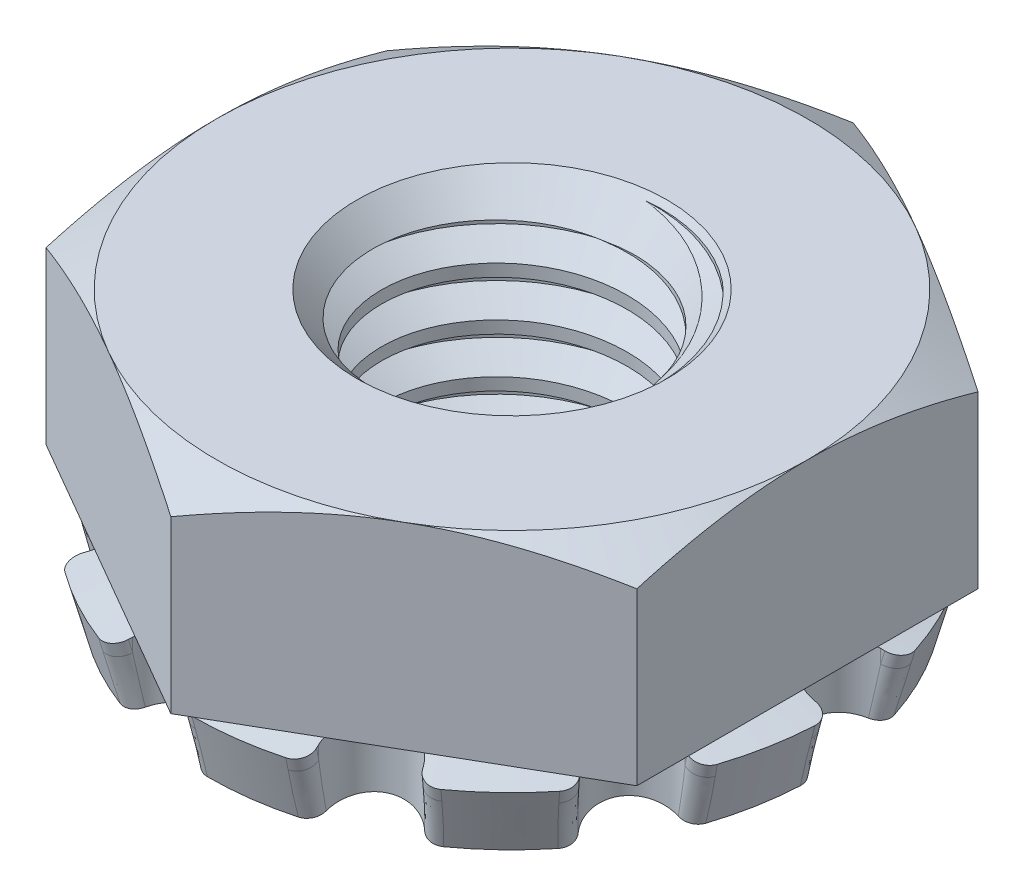
from build123d import *

# Parameters (mm, degrees)
BOSS_EXTRUDE1_DEPTH          = 4.365625
SKETCH2_OUTSIDE_W            = 47.418
SKETCH2_OUTSIDE_H            = 48.89
SKETCH2_OUTSIDE_R            = 4.7625
CUT_EXTRUDE1_DEPTH           = 9.484218461
CUT_EXTRUDE1_DRAFT           = -60
SKETCH4_R                    = 2.413
CUT_EXTRUDE3_DEPTH           = 4.365625
SWEEP1_PITCH                 = 0.79375
SWEEP1_HEIGHT                = 5.159375
SWEEP1_RADIUS                = 2.413
SKETCH7_R                    = 2.498925958
CUT_EXTRUDE4_OTHER_WAY_DEPTH = 9.93302879
CUT_EXTRUDE4_OTHER_WAY_TAPER = -45
SKETCH8_R                    = 2.498925958
CUT_EXTRUDE5_OTHER_WAY_DEPTH = 9.484218633
CUT_EXTRUDE5_OTHER_WAY_TAPER = -45
SKETCH9_W                    = 1.895636314
SKETCH9_H                    = 1.190625
CUT_EXTRUDE6_DEPTH           = 1.190625
FILLET1_R                    = 0.254
CIRPATTERN1_COUNT            = 10
FILLET1_OF_CIRPATTERN1_R     = 0.254


with BuildPart() as part:
    # Sketch1 → Boss-Extrude1 (new body)
    with BuildSketch(Plane(origin=(0, 0, 0), x_dir=(1, 0, 0), z_dir=(0, 1, 0))):
        Polygon((0, 5.499261314), (-4.7625, 2.749630657), (-4.7625, -2.749630657), (0, -5.499261314), (4.7625, -2.749630657), (4.7625, 2.749630657), align=None)
    extrude(amount=BOSS_EXTRUDE1_DEPTH)


with BuildPart() as cut_extrude1_tool:
    # Sketch2 outside → Cut-Extrude1 (with draft: the straight prism first)
    with BuildSketch(Plane(origin=(0, 4.365625, 0), x_dir=(1, 0, 0), z_dir=(0, 1, 0))):
        Rectangle(SKETCH2_OUTSIDE_W, SKETCH2_OUTSIDE_H)
        Circle(SKETCH2_OUTSIDE_R, mode=Mode.SUBTRACT)
    extrude(amount=-CUT_EXTRUDE1_DEPTH)
    # Cut-Extrude1: the draft: its side faces are tilted about the plane it starts from
    cut_extrude1_sides = [cut_extrude1_tool.faces().sort_by_distance(p)[0] for p in [
        (0, -0.37648423, 24.445),
        (23.709, -0.37648423, 0),
        (0, -0.37648423, -24.445),
        (-23.709, -0.37648423, 0),
        (-4.7625, -0.37648423, 0),
    ]]
    draft(cut_extrude1_sides, Plane(origin=(0, 4.365625, 0), x_dir=(1, 0, 0), z_dir=(0, 1, 0)), CUT_EXTRUDE1_DRAFT)


with BuildPart() as part_1:
    add(part.part)

    # Cut-Extrude1: cut by cut_extrude1_tool
    add(cut_extrude1_tool.part, mode=Mode.SUBTRACT)

    # Sketch4 → Cut-Extrude3 (cut)
    with BuildSketch(Plane(origin=(0, 4.365625, 0), x_dir=(1, 0, 0), z_dir=(0, 1, 0))):
        with Locations(Location((0, 0, 0), (0, 0, 270))):
            Circle(SKETCH4_R)
    extrude(amount=-CUT_EXTRUDE3_DEPTH, mode=Mode.SUBTRACT)

    # Sweep1: sweep along a helix
    with BuildLine() as sweep1_path:
        Helix(SWEEP1_PITCH, SWEEP1_HEIGHT, SWEEP1_RADIUS, center=(0, 4.365625, 0), direction=(0, -1, 0))
    # Sketch6 → Sweep1 (sweep)
    with BuildSketch(Plane(origin=(0, 0, 0), x_dir=(0, 0, -1), z_dir=(1, 0, 0))):
        Polygon((2.455962979, 5.084960937), (1.98337021, 4.812109375), (1.98337021, 4.613671875), (2.455962979, 4.340820312), align=None)
    sweep(path=sweep1_path.line, is_frenet=True)

    # Cut-Extrude4 cone 1 section (through the dimple's axis) → Cut-Extrude4 (revolve, cut)
    with BuildSketch(Plane(origin=(0, 4.365625, 0), x_dir=(0, 0, 1), z_dir=(1, 0, 0))):
        Polygon((0, 0), (2.498925958, 0), (0, 2.498925958), align=None)
    revolve(axis=Axis((0, 4.365625, 0), (0, -1, 0)), mode=Mode.SUBTRACT)

    # Sketch7 → Cut-Extrude4 other way (cut)
    with BuildSketch(Plane(origin=(0, 4.365625, 0), x_dir=(1, 0, 0), z_dir=(0, 1, 0))):
        Circle(SKETCH7_R)
    extrude(amount=CUT_EXTRUDE4_OTHER_WAY_DEPTH, taper=CUT_EXTRUDE4_OTHER_WAY_TAPER, mode=Mode.SUBTRACT)

    # Cut-Extrude5 cone 1 section (through the dimple's axis) → Cut-Extrude5 (revolve, cut)
    with BuildSketch(Plane(origin=(0, 0, 0), x_dir=(0, 0, -1), z_dir=(1, 0, 0))):
        Polygon((0, 0), (2.498925958, 0), (0, 2.498925958), align=None)
    revolve(axis=Axis((0, 0, 0), (0, 1, 0)), mode=Mode.SUBTRACT)

    # Sketch8 → Cut-Extrude5 other way (cut)
    with BuildSketch(Plane.XZ):
        Circle(SKETCH8_R)
    extrude(amount=CUT_EXTRUDE5_OTHER_WAY_DEPTH, taper=CUT_EXTRUDE5_OTHER_WAY_TAPER, mode=Mode.SUBTRACT)

    # Sketch9 → Cut-Revolve1 (revolve, cut)
    with BuildSketch(Plane(origin=(0, 0, 0), x_dir=(0, 0, -1), z_dir=(1, 0, 0)), mode=Mode.PRIVATE) as cut_revolve1_sk:
        with Locations((4.551443157, 0.5953125)):
            Rectangle(SKETCH9_W, SKETCH9_H)
    revolve(cut_revolve1_sk.sketch.rotate(Axis((0, 0, 0), (0, 1, 0)), 301.134377146), axis=Axis((0, 0, 0), (0, 1, 0)), mode=Mode.SUBTRACT)

    # Sketch10 → Revolve1 (revolve)
    with BuildSketch(Plane(origin=(0, 0, 0), x_dir=(0, 0, -1), z_dir=(1, 0, 0)), mode=Mode.PRIVATE) as revolve1_sk:
        Polygon((3.603625, 1.190625), (4.394982425, 1.190625), (5.159375, 0.985806627), (4.89522891, 0), (4.130836336, 0.204818373), (3.603625, 0.204818373), align=None)
    revolve(revolve1_sk.sketch.rotate(Axis((0, 1.190625, 0), (0, -1, 0)), 180), axis=Axis((0, 1.190625, 0), (0, -1, 0)))

    # Sketch11 → Cut-Extrude6 (cut)
    with BuildSketch(Plane(origin=(0, 0, 0), x_dir=(1, 0, 0), z_dir=(0, 1, 0))):
        with BuildLine():
            Line((4.687975673, 1.256139296), (4.98357356, 1.335344511))
            ThreePointArc((4.98357356, 1.335344511), (5.115235832, 0.673433573), (5.159375, 0))
            Line((5.159375, 0), (4.853349548, 0))
            ThreePointArc((4.853349548, 0), (4.219860312, 0.55555515), (4.687975673, 1.256139296))
        make_face()
    cut_extrude6 = extrude(amount=CUT_EXTRUDE6_DEPTH, mode=Mode.SUBTRACT)

    # Fillet1
    fillet1_edges = [part_1.edges().sort_by_distance(p)[0] for p in [
        (4.856000795, 0.492903313, -1.301161491),
        (5.027301955, 0.492903313, 0),
    ]]
    fillet(fillet1_edges, radius=FILLET1_R)

    # CirPattern1: Cut-Extrude6 ×10 about axis
    cirpattern1_axis = Axis((0, 0, 0), (0, -1, 0))
    for i in range(1, CIRPATTERN1_COUNT):
        add(cut_extrude6.rotate(cirpattern1_axis, i * 360 / CIRPATTERN1_COUNT), mode=Mode.SUBTRACT)

    # Fillet1 of CirPattern1
    fillet1_of_cirpattern1_edges = [part_1.edges().sort_by_distance(p)[0] for p in [
        (4.693390703, 0.492903313, 1.801623893),
        (4.067172718, 0.492903313, 2.954973948),
        (2.738064886, 0.492903313, 4.216250186),
        (1.55352174, 0.492903313, 4.781248284),
        (-0.263108655, 0.492903313, 5.020412213),
        (-1.55352174, 0.492903313, 4.781248284),
        (-3.163783632, 0.492903313, 3.906947412),
        (-4.067172718, 0.492903313, 2.954973948),
        (-4.856000795, 0.492903313, 1.301161491),
        (-5.027301955, 0.492903313, 0),
        (-4.693390703, 0.492903313, -1.801623893),
        (-4.067172718, 0.492903313, -2.954973948),
        (-2.738064886, 0.492903313, -4.216250186),
        (-1.55352174, 0.492903313, -4.781248284),
        (0.263108655, 0.492903313, -5.020412213),
        (1.55352174, 0.492903313, -4.781248284),
        (3.163783632, 0.492903313, -3.906947412),
        (4.067172718, 0.492903313, -2.954973948),
    ]]
    fillet(fillet1_of_cirpattern1_edges, radius=FILLET1_OF_CIRPATTERN1_R)


solid = part_1.part
